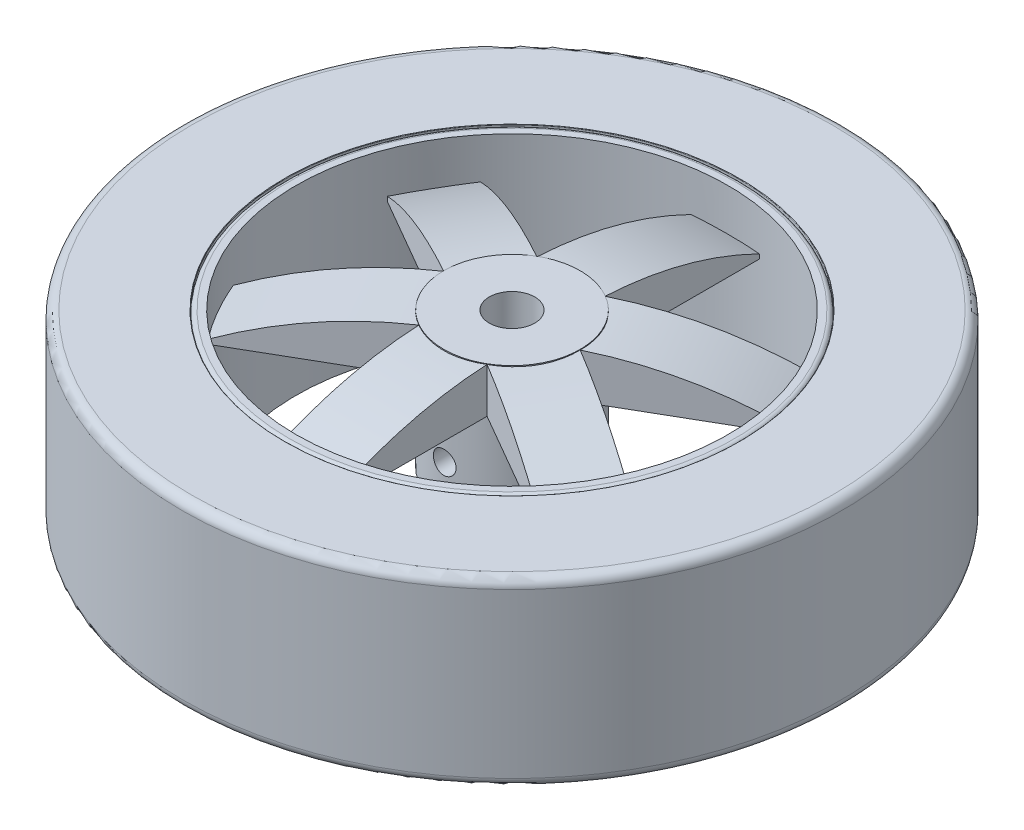
from build123d import *

# Parameters (mm, degrees)
SKETCH1_R             = 50
SKETCH1_R_2           = 47.5
BOSS_EXTRUDE1_DEPTH   = 40
SKETCH1_R_3           = 15
SKETCH1_R_4           = 5
BOSS_EXTRUDE1_2_DEPTH = 40
BOSS_EXTRUDE2_DEPTH   = 7.5
CIRPATTERN1_COUNT     = 6
FILLET1_R             = 1
SKETCH5_R             = 72.5
SKETCH5_R_2           = 50
BOSS_EXTRUDE4_DEPTH   = 40
FILLET2_R             = 2
FILLET3_R             = 0.1
SKETCH7_R             = 15
CUT_EXTRUDE1_DEPTH    = 10
SKETCH8_R             = 2.5
CUT_EXTRUDE2_DEPTH    = 17.5


with BuildPart() as part:
    # Sketch1 → Boss-Extrude1 (new body)
    with BuildSketch(Plane(origin=(0, 0, 0), x_dir=(1, 0, 0), z_dir=(0, 1, 0))):
        Circle(SKETCH1_R)
        Circle(SKETCH1_R_2, mode=Mode.SUBTRACT)
    extrude(amount=BOSS_EXTRUDE1_DEPTH)

    # Sketch2 → Boss-Extrude2 (add, symmetric)
    with BuildSketch(Plane(origin=(0, 0, 0), x_dir=(0, 0, -1), z_dir=(1, 0, 0))):
        with BuildLine():
            Line((48.889169482, 30), (8.889169482, 30))
            Line((8.889169482, 30), (8.889169482, 40))
            add(Edge.make_bspline(
                [(8.889169482, 40), (29.868778493, 39.876907844), (48.889169482, 30)],
                knots=[0, 0, 0, 1, 1, 1], degree=2))
        make_face()
    boss_extrude2 = extrude(amount=BOSS_EXTRUDE2_DEPTH, both=True)

    # CirPattern1: Boss-Extrude2 ×6 about axis
    cirpattern1_axis = Axis((0, 40, 0), (0, 1, 0))
    for i in range(1, CIRPATTERN1_COUNT):
        add(boss_extrude2.rotate(cirpattern1_axis, i * 360 / CIRPATTERN1_COUNT))

    # Fillet1
    fillet1_edges = [part.edges().sort_by_distance(p)[0] for p in [
        (-50, 0, 0),
        (-50, 40, 0),
    ]]
    fillet(fillet1_edges, radius=FILLET1_R)


with BuildPart() as body_2:
    # Sketch1 → Boss-Extrude1 2 (new body)
    with BuildSketch(Plane(origin=(0, 0, 0), x_dir=(1, 0, 0), z_dir=(0, 1, 0))):
        Circle(SKETCH1_R_3)
        Circle(SKETCH1_R_4, mode=Mode.SUBTRACT)
    extrude(amount=BOSS_EXTRUDE1_2_DEPTH)


    add(part.part)  # Boss-Extrude4 merges part
    # Sketch5 → Boss-Extrude4 (add)
    with BuildSketch(Plane(origin=(0, 0, 0), x_dir=(1, 0, 0), z_dir=(0, 1, 0))):
        Circle(SKETCH5_R)
        Circle(SKETCH5_R_2, mode=Mode.SUBTRACT)
    extrude(amount=BOSS_EXTRUDE4_DEPTH)

    # Fillet2
    fillet2_edges = [body_2.edges().sort_by_distance(p)[0] for p in [
        (-72.5, 0, 0),
        (-72.5, 40, 0),
    ]]
    fillet(fillet2_edges, radius=FILLET2_R)

    # Fillet3
    fillet3_edges = [body_2.edges().sort_by_distance(p)[0] for p in [
        (-50, 40, 0),
    ]]
    fillet(fillet3_edges, radius=FILLET3_R)

    # Sketch7 → Cut-Extrude1 (cut)
    with BuildSketch(Plane.XZ):
        Circle(SKETCH7_R)
    extrude(amount=-CUT_EXTRUDE1_DEPTH, mode=Mode.SUBTRACT)

    # Sketch8 → Cut-Extrude2 (cut, symmetric)
    with BuildSketch(Plane.XY):
        with Locations((0, 18.5)):
            Circle(SKETCH8_R)
    extrude(amount=CUT_EXTRUDE2_DEPTH, both=True, mode=Mode.SUBTRACT)


solid = body_2.part
